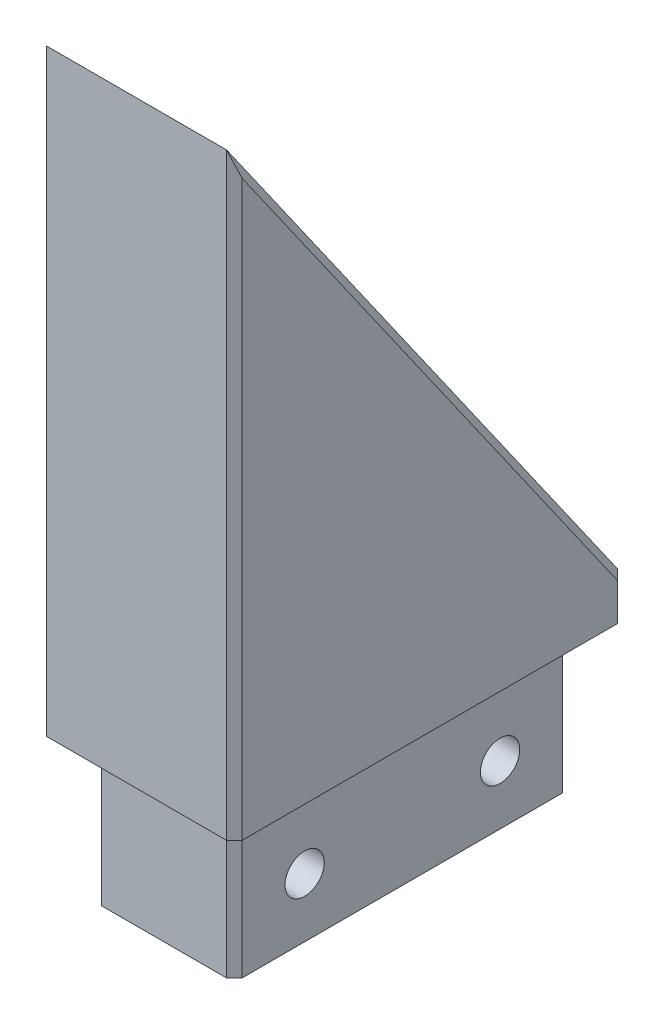
from build123d import *

# Parameters (mm, degrees)
BOSS_EXTRUDE1_DEPTH = 12.7
SKETCH2_W           = 18.288
SKETCH2_H           = 43.688
BOSS_EXTRUDE2_DEPTH = 19.05
SKETCH3_R           = 2.5527
CUT_EXTRUDE1_DEPTH  = 96.387737744
CHAMFER1_SIZE       = 1


with BuildPart() as part:
    # Sketch1 → Boss-Extrude1 (new, symmetric)
    with BuildSketch(Plane(origin=(0, 0, 0), x_dir=(0, 0, -1), z_dir=(1, 0, 0))):
        Polygon((0, 0), (0, 77.724), (50.8, 5.174081258), (50.8, 0), align=None)
    extrude(amount=BOSS_EXTRUDE1_DEPTH, both=True)

    # Sketch2 → Boss-Extrude2 (add)
    with BuildSketch(Plane.XZ):
        with Locations((0, -25.4)):
            Rectangle(SKETCH2_W, SKETCH2_H)
    extrude(amount=BOSS_EXTRUDE2_DEPTH)

    # Sketch3 → Cut-Extrude1 (cut, through all)
    with BuildSketch(Plane(origin=(9.144, 0, 0), x_dir=(0, 0, -1), z_dir=(1, 0, 0))):
        with Locations((38.1, -11.375365521)):
            Circle(SKETCH3_R)
        with Locations((12.7, -11.375365521)):
            Circle(SKETCH3_R)
    extrude(amount=-CUT_EXTRUDE1_DEPTH, mode=Mode.SUBTRACT)

    # Chamfer1
    chamfer1_edges = [part.edges().sort_by_distance(p)[0] for p in [
        (-9.144, -9.525, -3.556),
        (9.144, -9.525, -3.556),
        (-9.144, -9.525, -47.244),
        (9.144, -9.525, -47.244),
        (-12.7, 2.587040629, -50.8),
        (-12.7, 41.449040629, -25.4),
        (-12.7, 38.862, 0),
        (12.7, 2.587040629, -50.8),
        (12.7, 41.449040629, -25.4),
        (12.7, 38.862, 0),
    ]]
    chamfer(chamfer1_edges, length=CHAMFER1_SIZE)


solid = part.part
